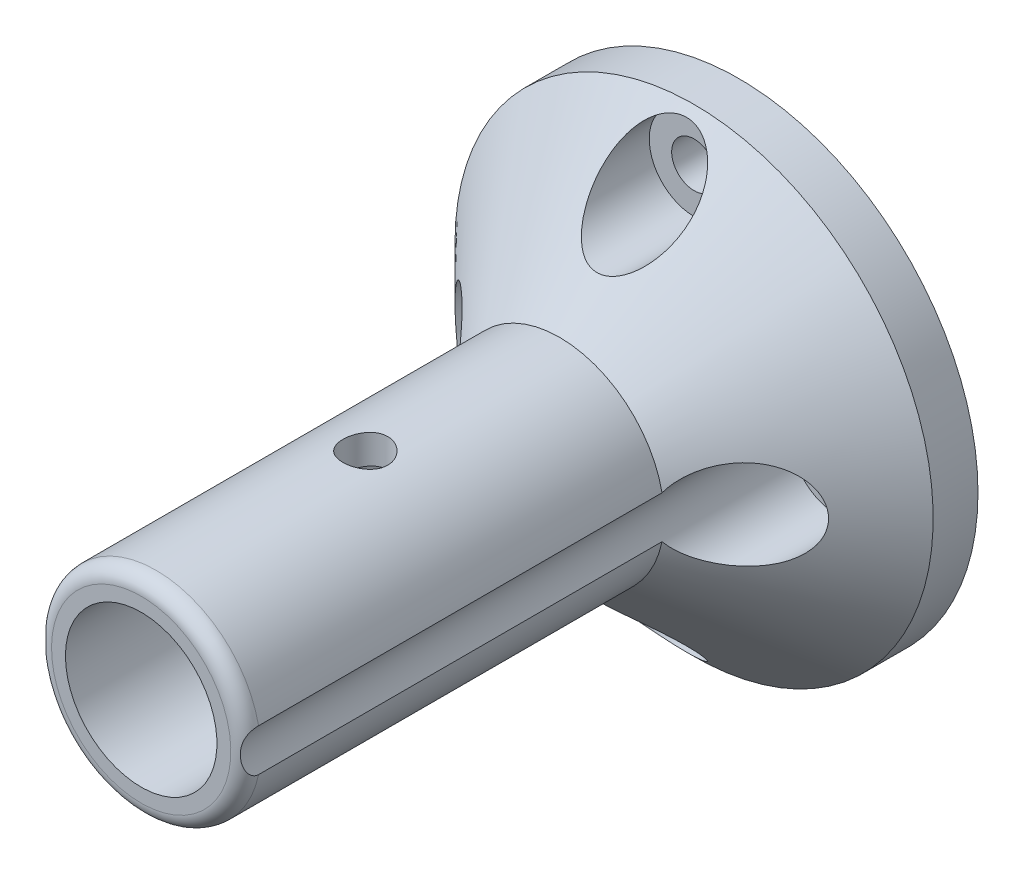
from build123d import *

# Parameters (mm, degrees)
SKETCH_1_R               = 16
EXTRUDE_1_DEPTH          = 40
SKETCH_2_W               = 5.07
SKETCH_2_H               = 40
SKETCH_3_R               = 1.5
CUT_EXTRUDE_2_DEPTH      = 46.956501172
SKETCH_4_R               = 3
SKETCH_4_R_2             = 1.5
CUT_EXTRUDE_3_DEPTH      = 44.370496958
CUT_EXTRUDE_4_DEPTH      = 46.956501329
CUT_EXTRUDE_4_DEPTH_BACK = 46.956501329
SKETCH_5_R               = 1.5


with BuildPart() as part:
    # 草图1 → 凸台-拉伸1 (new body)
    with BuildSketch(Plane.XY):
        Circle(SKETCH_1_R)
    extrude(amount=EXTRUDE_1_DEPTH)

    # 草图2 → 切除-旋转1 (revolve, cut)
    with BuildSketch(Plane(origin=(0, 0, 0), x_dir=(1, 0, 0), z_dir=(0, 1, 0))):
        Polygon((-16, -40), (-16, -3), (-7, -12), (-7, -40), align=None)
        with Locations((-2.535, -20)):
            Rectangle(SKETCH_2_W, SKETCH_2_H)
    revolve(axis=Axis((0, 0, 0), (0, 0, 1)), mode=Mode.SUBTRACT)

    # 草图3 → 切除-拉伸2 (cut, through all)
    with BuildSketch(Plane.XY):
        with Locations(Location((0, -12.5, 0), (0, 0, 237.240983175))):
            Circle(SKETCH_3_R)
        with Locations(Location((-9.5, 0, 0), (0, 0, 179.999999805))):
            Circle(SKETCH_3_R)
        with Locations(Location((9.5, 0, 0), (0, 0, 259.790179824))):
            Circle(SKETCH_3_R)
        with Locations(Location((0, 12.5, 0), (0, 0, 122.759016825))):
            Circle(SKETCH_3_R)
    extrude(amount=CUT_EXTRUDE_2_DEPTH, mode=Mode.SUBTRACT)

    # 草图4 → 切除-拉伸3 (cut, through all)
    # profile 1 of 4: a face of its own
    with BuildSketch(Plane.XY.offset(3)):
        with Locations(Location((0, 12.5, 0), (0, 0, 206.851583032))):
            Circle(SKETCH_4_R)
        with Locations((0, 12.5)):
            Circle(SKETCH_4_R_2, mode=Mode.SUBTRACT)
    # profile 2 of 4: a face of its own
    with BuildSketch(Plane.XY.offset(3)):
        with Locations(Location((-9.5, 0, 0), (0, 0, 179.999999996))):
            Circle(SKETCH_4_R)
        with Locations((-9.5, 0)):
            Circle(SKETCH_4_R_2, mode=Mode.SUBTRACT)
    # profile 3 of 4: a face of its own
    with BuildSketch(Plane.XY.offset(3)):
        with Locations(Location((9.5, 0, 0), (0, 0, 208.166578237))):
            Circle(SKETCH_4_R)
        with Locations((9.5, 0)):
            Circle(SKETCH_4_R_2, mode=Mode.SUBTRACT)
    # profile 4 of 4: a face of its own
    with BuildSketch(Plane.XY.offset(3)):
        with Locations(Location((0, -12.5, 0), (0, 0, 225.843438768))):
            Circle(SKETCH_4_R)
        with Locations((0, -12.5)):
            Circle(SKETCH_4_R_2, mode=Mode.SUBTRACT)
    extrude(amount=CUT_EXTRUDE_3_DEPTH, mode=Mode.SUBTRACT)

    # 草图5 → 切除-拉伸4 (cut, two sides: drawn at the far end of the back side and taken through both)
    with BuildSketch(Plane(origin=(0, 0, 0), x_dir=(1, 0, 0), z_dir=(0, 1, 0)).offset(-CUT_EXTRUDE_4_DEPTH_BACK)):
        with Locations(Location((0, -25, 0), (0, 0, 270))):
            Circle(SKETCH_5_R)
    extrude(amount=CUT_EXTRUDE_4_DEPTH + CUT_EXTRUDE_4_DEPTH_BACK, mode=Mode.SUBTRACT)

    # 圆角1: read off the stored shape, not the designer's step
    # 圆角1 outline → 圆角1 (revolve, cut)
    with BuildSketch(Plane.XZ):
        with BuildLine():
            ThreePointArc((6, 40), (6.707106781, 39.707106781), (7, 39))
            Line((7, 39), (7, 40))
            Line((7, 40), (6, 40))
        make_face()
    revolve(axis=Axis((0, 0, 0), (0, 0, 1)), mode=Mode.SUBTRACT)


solid = part.part
